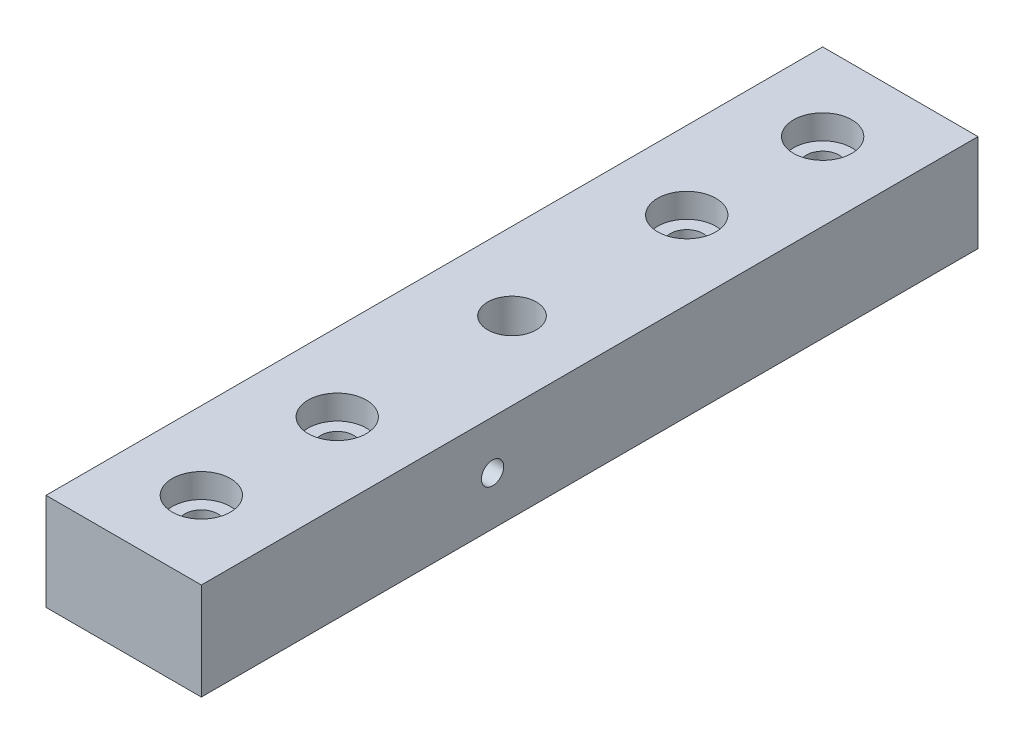
from build123d import *

# Parameters (mm, degrees)
SKETCH1_W           = 16
SKETCH1_H           = 80
BOSS_EXTRUDE1_DEPTH = 10
SKETCH2_R           = 2.35
CUT_EXTRUDE1_DEPTH  = 2.5
SKETCH2_3_R         = 1.7
CUT_EXTRUDE2_DEPTH  = 82.018516402
CUT_EXTRUDE3_START  = 7.5
SKETCH2_4_R         = 3
CUT_EXTRUDE3_DEPTH  = 74.518516402
SKETCH3_R           = 1.15
CUT_EXTRUDE4_DEPTH  = 83.194890352
SKETCH6_R           = 2.5
CUT_EXTRUDE6_DEPTH  = 25


with BuildPart() as part:
    # Sketch1 → Boss-Extrude1 (new body)
    with BuildSketch(Plane(origin=(0, 0, 0), x_dir=(1, 0, 0), z_dir=(0, 1, 0))):
        with Locations((0, 40)):
            Rectangle(SKETCH1_W, SKETCH1_H)
    extrude(amount=BOSS_EXTRUDE1_DEPTH)

    # Sketch2 → Cut-Extrude1 (cut)
    with BuildSketch(Plane(origin=(0, 0, 0), x_dir=(1, 0, 0), z_dir=(0, 1, 0))):
        with Locations((0, 72)):
            Circle(SKETCH2_R)
        with Locations((0, 58)):
            Circle(SKETCH2_R)
        with Locations((0, 22)):
            Circle(SKETCH2_R)
        with Locations((0, 8)):
            Circle(SKETCH2_R)
    extrude(amount=CUT_EXTRUDE1_DEPTH, mode=Mode.SUBTRACT)

    # Sketch2<3> → Cut-Extrude2 (cut, through all)
    with BuildSketch(Plane(origin=(0, 0, 0), x_dir=(1, 0, 0), z_dir=(0, 1, 0))):
        with Locations((0, 72)):
            Circle(SKETCH2_3_R)
        with Locations((0, 58)):
            Circle(SKETCH2_3_R)
        with Locations((0, 22)):
            Circle(SKETCH2_3_R)
        with Locations((0, 8)):
            Circle(SKETCH2_3_R)
    extrude(amount=CUT_EXTRUDE2_DEPTH, mode=Mode.SUBTRACT)

    # Sketch2<4> → Cut-Extrude3 (cut, through all)
    with BuildSketch(Plane(origin=(0, 0, 0), x_dir=(1, 0, 0), z_dir=(0, 1, 0)).offset(CUT_EXTRUDE3_START)):
        with Locations((0, 72)):
            Circle(SKETCH2_4_R)
        with Locations((0, 58)):
            Circle(SKETCH2_4_R)
        with Locations((0, 22)):
            Circle(SKETCH2_4_R)
        with Locations((0, 8)):
            Circle(SKETCH2_4_R)
    extrude(amount=CUT_EXTRUDE3_DEPTH, mode=Mode.SUBTRACT)

    # Sketch3 → Cut-Extrude4 (cut, through all)
    with BuildSketch(Plane(origin=(8, 0, 0), x_dir=(0, 0, -1), z_dir=(1, 0, 0))):
        with Locations((30, 5)):
            Circle(SKETCH3_R)
    extrude(amount=-CUT_EXTRUDE4_DEPTH, mode=Mode.SUBTRACT)

    # Sketch6 → Cut-Extrude6 (cut)
    with BuildSketch(Plane(origin=(0, 10, 0), x_dir=(-1, 0, 0), z_dir=(0, -1, 0))):
        with Locations((0, 40)):
            Circle(SKETCH6_R)
    extrude(amount=CUT_EXTRUDE6_DEPTH, mode=Mode.SUBTRACT)


solid = part.part
